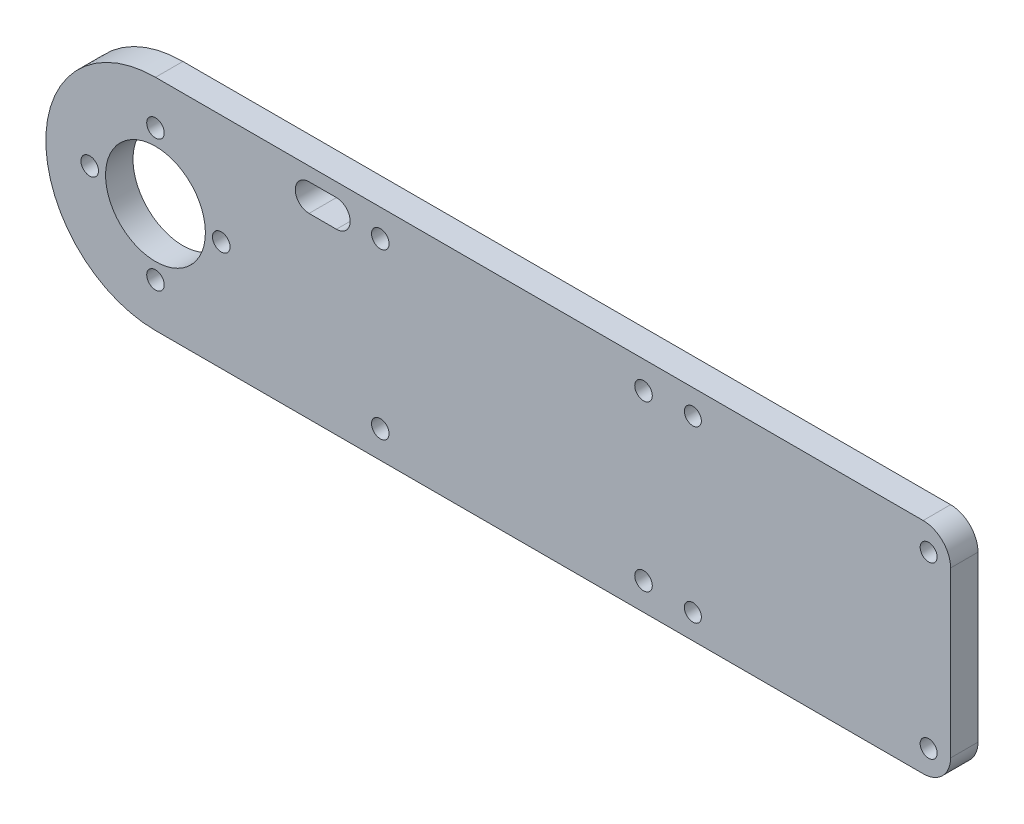
from build123d import *

# Parameters (mm, degrees)
SKETCH2_R           = 9.1
BOSS_EXTRUDE1_DEPTH = 2.5
FILLET1_R           = 5
SKETCH3_R           = 1.55
SKETCH3_R_2         = 1.6
CUT_EXTRUDE1_DEPTH  = 147.458185159
CUT_EXTRUDE2_DEPTH  = 10


with BuildPart() as part:
    # Sketch2 → Boss-Extrude1 (new, symmetric)
    with BuildSketch(Plane.XY):
        with BuildLine():
            Line((145, 20), (0, 20))
            ThreePointArc((0, 20), (-20, 0), (0, -20))
            Line((0, -20), (145, -20))
            Line((145, -20), (145, 20))
        make_face()
        Circle(SKETCH2_R, mode=Mode.SUBTRACT)
    extrude(amount=BOSS_EXTRUDE1_DEPTH, both=True)

    # Fillet1
    fillet1_edges = [part.edges().sort_by_distance(p)[0] for p in [
        (145, -20, 0),
        (145, 20, 0),
    ]]
    fillet(fillet1_edges, radius=FILLET1_R)

    # Sketch3 → Cut-Extrude1 (cut, through all)
    with BuildSketch(Plane(origin=(0, 0, -2.5), x_dir=(-1, 0, 0), z_dir=(0, 0, -1))):
        with Locations((-98, 15.5)):
            Circle(SKETCH3_R)
        with Locations((-89, 15)):
            Circle(SKETCH3_R_2)
        with Locations((0, 12)):
            Circle(SKETCH3_R_2)
        with Locations((-12, 0)):
            Circle(SKETCH3_R_2)
        with Locations((12, 0)):
            Circle(SKETCH3_R_2)
        with Locations((0, -12)):
            Circle(SKETCH3_R_2)
        with Locations((-41, 15)):
            Circle(SKETCH3_R_2)
        with Locations((-98, -15.5)):
            Circle(SKETCH3_R)
        with Locations((-141, -15.5)):
            Circle(SKETCH3_R)
        with Locations((-141, 15.5)):
            Circle(SKETCH3_R)
        with Locations((-89, -15)):
            Circle(SKETCH3_R_2)
        with Locations((-41, -15)):
            Circle(SKETCH3_R_2)
    extrude(amount=-CUT_EXTRUDE1_DEPTH, mode=Mode.SUBTRACT)

    # Sketch3<4> → Cut-Extrude2 (cut)
    with BuildSketch(Plane(origin=(0, 0, -2.5), x_dir=(-1, 0, 0), z_dir=(0, 0, -1))):
        with BuildLine():
            ThreePointArc((-33, 17.5), (-34.767766953, 16.767766953), (-35.5, 15))
            ThreePointArc((-35.5, 15), (-34.767766953, 13.232233047), (-33, 12.5))
            Line((-33, 12.5), (-28, 12.5))
            ThreePointArc((-28, 12.5), (-25.5, 15), (-28, 17.5))
            Line((-28, 17.5), (-33, 17.5))
        make_face()
    extrude(amount=-CUT_EXTRUDE2_DEPTH, mode=Mode.SUBTRACT)


solid = part.part
